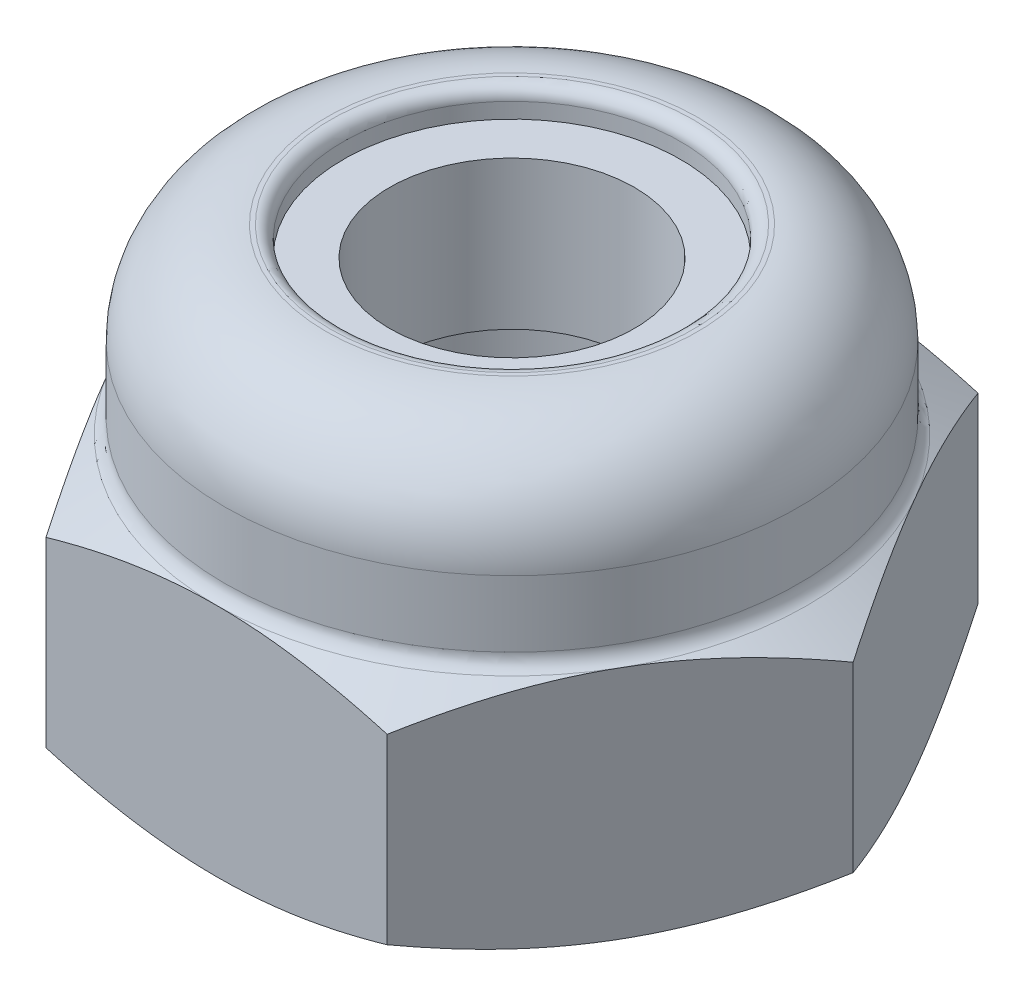
from build123d import *

# Parameters (mm, degrees)
SKETCH_1_R      = 1.65
EXTRUDE_1_DEPTH = 1.45
SKETCH_5_W      = 1.05
SKETCH_5_H      = 1.756666667
FILLET_1_R      = 1.2
FILLET_3_R      = 0.15
FILLET_4_R      = 0.2
FILLET_5_R      = 0.3


with BuildPart() as part:
    # 草图1 → 凸台-拉伸1 (new, symmetric)
    with BuildSketch(Plane(origin=(0, 0, 0), x_dir=(1, 0, 0), z_dir=(0, 1, 0))):
        Polygon((4.041451884, 0), (2.020725942, 3.5), (-2.020725942, 3.5), (-4.041451884, 0), (-2.020725942, -3.5), (2.020725942, -3.5), align=None)
        with Locations(Location((0, 0, 0), (0, 0, 270))):
            Circle(SKETCH_1_R, mode=Mode.SUBTRACT)
    extrude(amount=EXTRUDE_1_DEPTH, both=True)

    # 草图4 → 旋转1 (revolve)
    with BuildSketch(Plane(origin=(0, 0, 0), x_dir=(0, 0, -1), z_dir=(1, 0, 0))):
        Polygon((-3.4, 1.45), (-3.4, 3.55), (-2, 3.55), (-2, 3.216666667), (-2.5, 3.216666667), (-2.5, 1.45), align=None)
    revolve(axis=Axis((0, 2.804536462, 0), (0, -1, 0)))

    # 草图5 → 旋转2 (revolve)
    with BuildSketch(Plane(origin=(0, 0, 0), x_dir=(0, 0, -1), z_dir=(1, 0, 0))):
        with Locations((-1.975, 2.328333334)):
            Rectangle(SKETCH_5_W, SKETCH_5_H)
    revolve(axis=Axis((0, 2.51357275, 0), (0, -1, 0)))

    # 圆角1
    fillet_1_edges = [part.edges().sort_by_distance(p)[0] for p in [
        (0, 3.55, -3.4),
    ]]
    fillet(fillet_1_edges, radius=FILLET_1_R)

    # 圆角3
    fillet_3_edges = [part.edges().sort_by_distance(p)[0] for p in [
        (0, 3.55, -2),
    ]]
    fillet(fillet_3_edges, radius=FILLET_3_R)

    # 草图6 → 切除-旋转1 (revolve, cut)
    with BuildSketch(Plane(origin=(0, 0, 0), x_dir=(0, 0, -1), z_dir=(1, 0, 0)), mode=Mode.PRIVATE) as cut_revolve_1_sk:
        Polygon((3.4, 1.45), (5.824871131, 1.45), (5.824871131, 0.05), align=None)
        Polygon((5.824871131, -0.05), (3.4, -1.45), (5.824871131, -1.45), align=None)
    revolve(cut_revolve_1_sk.sketch.rotate(Axis((0, 2.537572, 0), (0, -1, 0)), 30.000000005), axis=Axis((0, 2.537572, 0), (0, -1, 0)), mode=Mode.SUBTRACT)

    # 圆角4
    fillet_4_edges = [part.edges().sort_by_distance(p)[0] for p in [
        (3.284147809, 1.45, 0.879984753),
    ]]
    fillet(fillet_4_edges, radius=FILLET_4_R - 0.0001)  # a hair under: the kernel refuses the full size

    # 圆角5
    fillet_5_edges = [part.edges().sort_by_distance(p)[0] for p in [
        (-1.7, -1.45, 2.944486373),
    ]]
    fillet(fillet_5_edges, radius=FILLET_5_R)


solid = part.part
